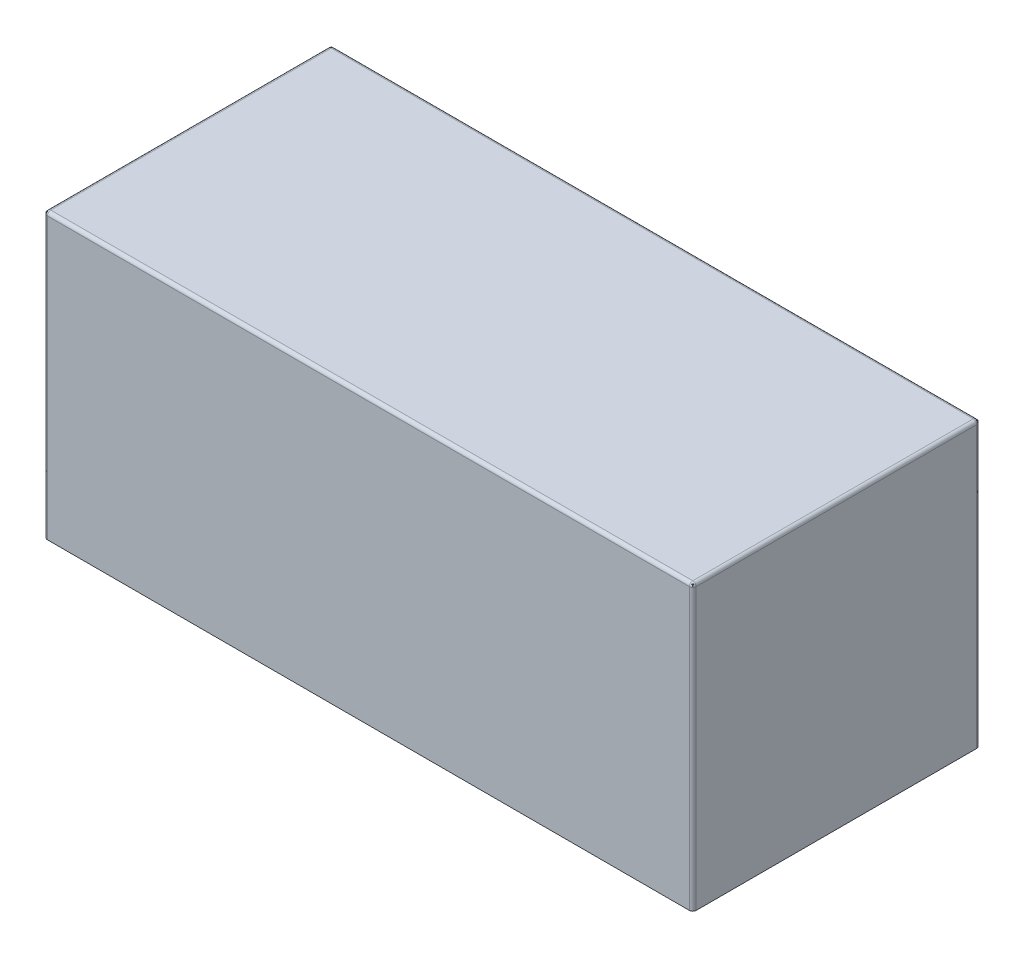
from build123d import *

# Parameters (mm, degrees)
SKETCH2_W           = 960
SKETCH2_H           = 425
SKETCH2_W_2         = 956.825
SKETCH2_H_2         = 421.825
BOSS_EXTRUDE1_DEPTH = 420
BOSS_EXTRUDE2_START = 420
SKETCH3_W           = 960
SKETCH3_H           = 425
BOSS_EXTRUDE2_DEPTH = 1.5875
FILLET2_R           = 5
CUT_EXTRUDE1_REACH  = 1071.185
SKETCH4_W           = 80
SKETCH4_H           = 80


with BuildPart() as part:
    # Sketch2 → Boss-Extrude1 (new body)
    with BuildSketch(Plane(origin=(0, 0, 0), x_dir=(1, 0, 0), z_dir=(0, 1, 0))):
        Rectangle(SKETCH2_W, SKETCH2_H)
        Rectangle(SKETCH2_W_2, SKETCH2_H_2, mode=Mode.SUBTRACT)
    extrude(amount=BOSS_EXTRUDE1_DEPTH)

    # Sketch3 → Boss-Extrude2 (add)
    with BuildSketch(Plane(origin=(0, 0, 0), x_dir=(1, 0, 0), z_dir=(0, 1, 0)).offset(BOSS_EXTRUDE2_START)):
        Rectangle(SKETCH3_W, SKETCH3_H)
    extrude(amount=-BOSS_EXTRUDE2_DEPTH)

    # Fillet2
    fillet2_edges = [part.edges().sort_by_distance(p)[0] for p in [
        (0, 420, 212.5),
        (-480, 420, 0),
        (0, 420, -212.5),
        (480, 420, 0),
        (480, 210, 212.5),
        (-480, 210, 212.5),
        (-480, 210, -212.5),
        (480, 210, -212.5),
    ]]
    fillet(fillet2_edges, radius=FILLET2_R)

    # Sketch4 → Cut-Extrude1 (cut, up to next)
    with BuildSketch(Plane.ZY.offset(480), mode=Mode.PRIVATE) as cut_extrude1_sk1:
        with Locations((0, 40)):
            Rectangle(SKETCH4_W, SKETCH4_H)
    cut_extrude1_tool1 = extrude(cut_extrude1_sk1.sketch, amount=-CUT_EXTRUDE1_REACH, mode=Mode.PRIVATE) & part.part
    add(cut_extrude1_tool1.solids().sort_by_distance((-480, 40, 0))[0], mode=Mode.SUBTRACT)


solid = part.part
